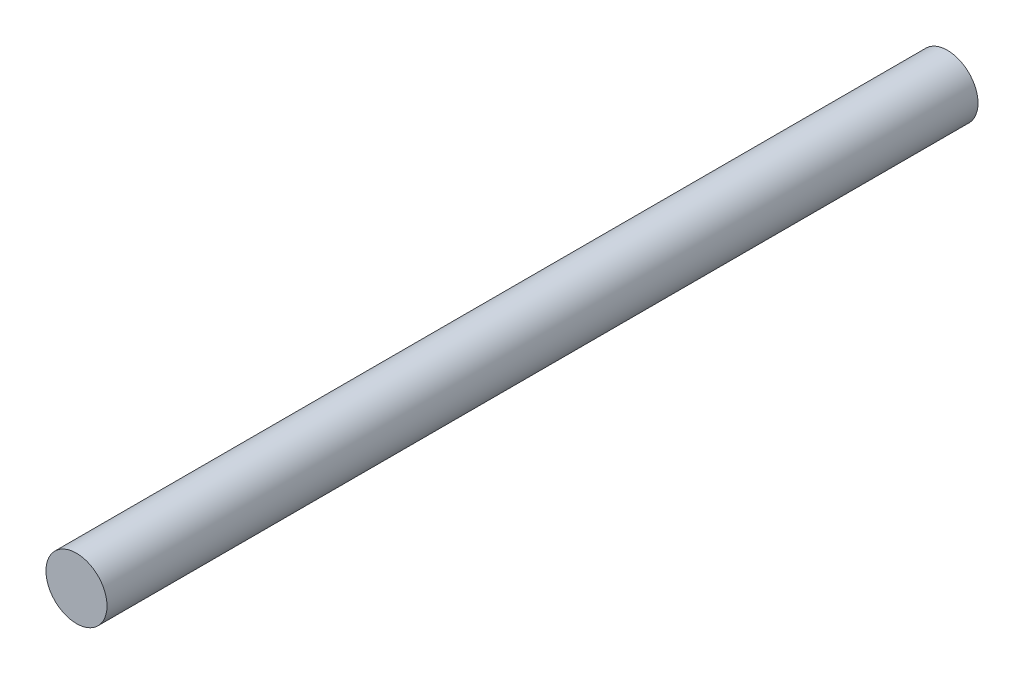
from build123d import *

# Parameters (mm, degrees)
BOSS_EXTRUDE1_DEPTH      = 35
BOSS_EXTRUDE1_DEPTH_BACK = 35
SKETCH1_R                = 2.5
MOVE_START               = -35
MOVE_FACE1_OUTLINE_R     = 2.5
MOVE_FACE1_OUTLINE_R_2   = 2.45
MOVE_FACE1_DEPTH         = 70
MOVE_FACE1_2_OUTLINE_R   = 2.45
MOVE_FACE1_2_DEPTH       = 0.05
MOVE_START_2             = 34.95
MOVE_FACE1_3_OUTLINE_R   = 2.45
MOVE_FACE1_3_DEPTH       = 0.05


# Read off the part's stored shape, not the designer's step: Move Face1
with BuildPart() as part:
    # Sketch1 → Boss-Extrude1 (new, two sides: drawn at the far end of the back side and taken through both)
    with BuildSketch(Plane.XY.offset(-BOSS_EXTRUDE1_DEPTH_BACK)):
        Circle(SKETCH1_R)
    extrude(amount=BOSS_EXTRUDE1_DEPTH + BOSS_EXTRUDE1_DEPTH_BACK)

    # Move Face1 outline → Move Face1 (cut)
    with BuildSketch(Plane.XY.offset(MOVE_START)):
        Circle(MOVE_FACE1_OUTLINE_R)
        Circle(MOVE_FACE1_OUTLINE_R_2, mode=Mode.SUBTRACT)
    extrude(amount=MOVE_FACE1_DEPTH, mode=Mode.SUBTRACT)

    # Move Face1 2 outline → Move Face1 2 (cut)
    with BuildSketch(Plane.XY.offset(MOVE_START)):
        Circle(MOVE_FACE1_2_OUTLINE_R)
    extrude(amount=MOVE_FACE1_2_DEPTH, mode=Mode.SUBTRACT)

    # Move Face1 3 outline → Move Face1 3 (cut)
    with BuildSketch(Plane.XY.offset(MOVE_START_2)):
        Circle(MOVE_FACE1_3_OUTLINE_R)
    extrude(amount=MOVE_FACE1_3_DEPTH, mode=Mode.SUBTRACT)


solid = part.part
